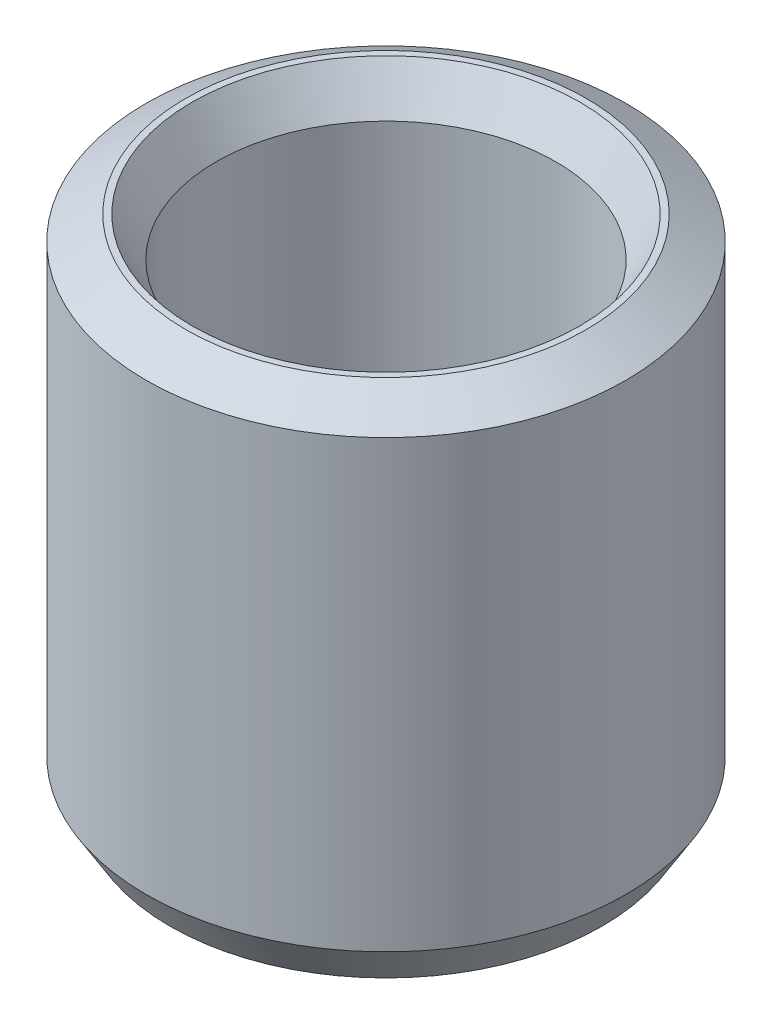
from build123d import *
from OCP.BRepFilletAPI import BRepFilletAPI_MakeChamfer

# Parameters (mm, degrees)
SKETCH1_R           = 35
BOSS_EXTRUDE1_DEPTH = 74.254336698
SKETCH2_R           = 24.77617676
CUT_EXTRUDE1_DEPTH  = 90.239601739
CHAMFER1_SIZE       = 3.506821876
CHAMFER1_SIZE2      = 5.779868667


with BuildPart() as part:
    # Sketch1 → Boss-Extrude1 (new body)
    with BuildSketch(Plane(origin=(0, 0, 0), x_dir=(1, 0, 0), z_dir=(0, 1, 0))):
        Circle(SKETCH1_R)
    extrude(amount=BOSS_EXTRUDE1_DEPTH)

    # Sketch2 → Cut-Extrude1 (cut, through all)
    with BuildSketch(Plane(origin=(0, 0, 0), x_dir=(1, 0, 0), z_dir=(0, 1, 0))):
        Circle(SKETCH2_R)
    extrude(amount=CUT_EXTRUDE1_DEPTH, mode=Mode.SUBTRACT)

    # Chamfer1: one chamfer whose edges measure the first distance from different faces: ONE call of the kernel's chamfer builder (chamfer() names one face for all edges)
    chamfer1_edges_1 = [part.edges().sort_by_distance(p)[0] for p in [
        (-24.77617676, 74.254336698, 0),
    ]]
    chamfer1_side_1 = [part.faces().sort_by_distance(p)[0] for p in [
        (-34.010050506, 74.254336698, 0),
    ]]
    chamfer1_edges_2 = [part.edges().sort_by_distance(p)[0] for p in [
        (-24.77617676, 0, 0),
    ]]
    chamfer1_side_2 = [part.faces().sort_by_distance(p)[0] for p in [
        (-24.77617676, 37.127168349, 0),
    ]]
    chamfer1_edges_3 = [part.edges().sort_by_distance(p)[0] for p in [
        (-35, 0, 0),
    ]]
    chamfer1_side_3 = [part.faces().sort_by_distance(p)[0] for p in [
        (-34.010050506, 0, 0),
    ]]
    chamfer1_edges_4 = [part.edges().sort_by_distance(p)[0] for p in [
        (-35, 74.254336698, 0),
    ]]
    chamfer1_side_4 = [part.faces().sort_by_distance(p)[0] for p in [
        (-35, 37.127168349, 0),
    ]]
    chamfer1 = BRepFilletAPI_MakeChamfer(part.part.solid().wrapped)
    for e in chamfer1_edges_1:
        chamfer1.Add(CHAMFER1_SIZE, CHAMFER1_SIZE2, e.wrapped, chamfer1_side_1[0].wrapped)  # the first distance lies on this face
    for e in chamfer1_edges_2:
        chamfer1.Add(CHAMFER1_SIZE, CHAMFER1_SIZE2, e.wrapped, chamfer1_side_2[0].wrapped)  # the first distance lies on this face
    for e in chamfer1_edges_3:
        chamfer1.Add(CHAMFER1_SIZE, CHAMFER1_SIZE2, e.wrapped, chamfer1_side_3[0].wrapped)  # the first distance lies on this face
    for e in chamfer1_edges_4:
        chamfer1.Add(CHAMFER1_SIZE, CHAMFER1_SIZE2, e.wrapped, chamfer1_side_4[0].wrapped)  # the first distance lies on this face
    add(Compound.cast(chamfer1.Shape()), mode=Mode.REPLACE)


solid = part.part
